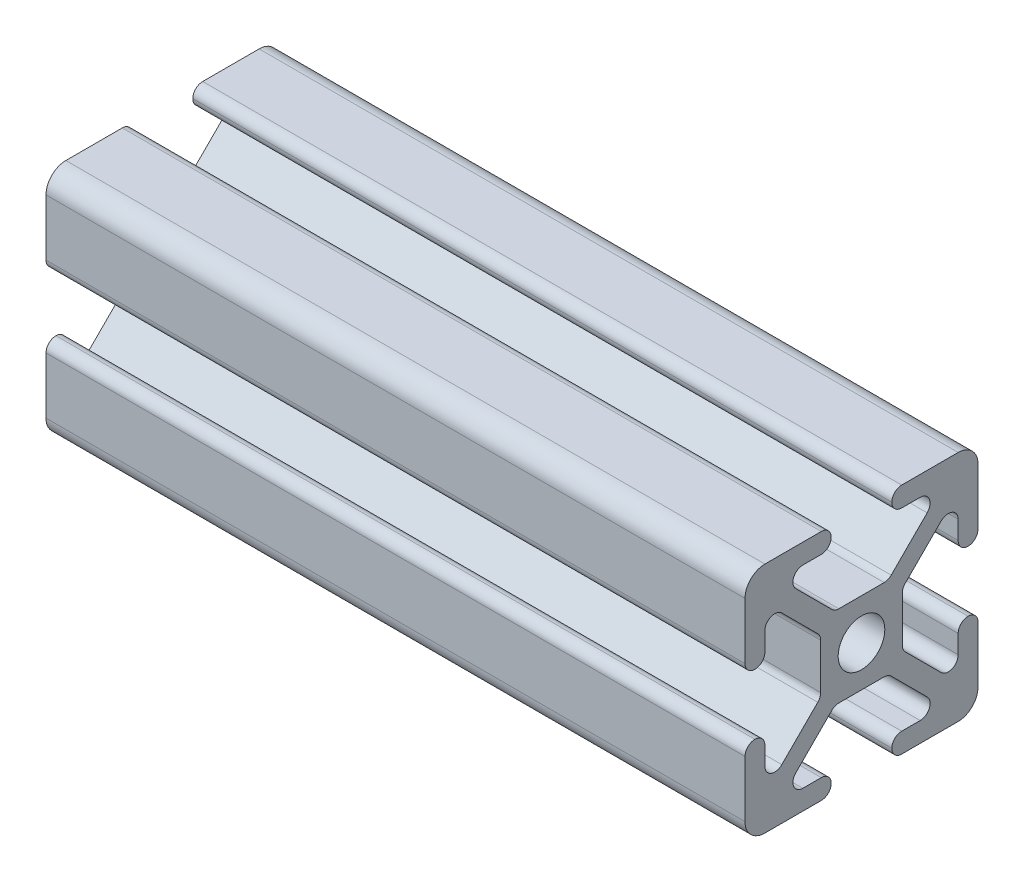
from build123d import *

# Parameters (mm, degrees)
SKETCH1_R           = 2.5
BOSS_EXTRUDE1_DEPTH = 75
FILLET1_R           = 1.065
FILLET2_R           = 2.13


with BuildPart() as part:
    # Sketch1 → Boss-Extrude1 (new body)
    with BuildSketch(Plane.YZ):
        Polygon((-12.5, -3.25), (-12.5, -12.5), (-3.25, -12.5), (-3.25, -10.37), (-8.863862556, -10.37), (-2.873862556, -4.38), (2.873862556, -4.38), (8.863862556, -10.37), (3.25, -10.37), (3.25, -12.5), (12.5, -12.5), (12.5, -3.25), (10.37, -3.25), (10.37, -8.863862556), (4.38, -2.873862556), (4.38, 2.873862556), (10.37, 8.863862556), (10.37, 3.25), (12.5, 3.25), (12.5, 12.5), (3.25, 12.5), (3.25, 10.37), (8.863862556, 10.37), (2.873862556, 4.38), (-2.873862556, 4.38), (-8.863862556, 10.37), (-3.25, 10.37), (-3.25, 12.5), (-12.5, 12.5), (-12.5, 3.25), (-10.37, 3.25), (-10.37, 8.863862556), (-4.38, 2.873862556), (-4.38, -2.873862556), (-10.37, -8.863862556), (-10.37, -3.25), align=None)
        with Locations(Location((0, 0, 0), (0, 0, 270))):
            Circle(SKETCH1_R, mode=Mode.SUBTRACT)
    extrude(amount=BOSS_EXTRUDE1_DEPTH)

    # Fillet1
    fillet1_edges = [part.edges().sort_by_distance(p)[0] for p in [
        (37.5, -10.37, -8.863862556),
        (37.5, 2.873862556, -4.38),
        (37.5, -2.873862556, -4.38),
        (37.5, -4.38, 2.873862556),
        (37.5, -4.38, -2.873862556),
        (37.5, -2.873862556, 4.38),
        (37.5, 2.873862556, 4.38),
        (37.5, 4.38, 2.873862556),
        (37.5, 4.38, -2.873862556),
        (37.5, -8.863862556, -10.37),
        (37.5, 8.863862556, -10.37),
        (37.5, 10.37, -8.863862556),
        (37.5, -10.37, 8.863862556),
        (37.5, -8.863862556, 10.37),
        (37.5, 10.37, 8.863862556),
        (37.5, 8.863862556, 10.37),
        (37.5, 12.5, 3.25),
        (37.5, -3.25, -12.5),
        (37.5, -10.37, 3.25),
        (37.5, 10.37, 3.25),
        (37.5, -10.37, -3.25),
        (37.5, -12.5, -3.25),
        (37.5, -12.5, 3.25),
        (37.5, 3.25, -10.37),
        (37.5, -3.25, -10.37),
        (37.5, 3.25, -12.5),
        (37.5, 10.37, -3.25),
        (37.5, 12.5, -3.25),
        (37.5, 3.25, 12.5),
        (37.5, 3.25, 10.37),
        (37.5, -3.25, 10.37),
        (37.5, -3.25, 12.5),
    ]]
    fillet(fillet1_edges, radius=FILLET1_R - 0.0001)  # a hair under: the kernel refuses the full size

    # Fillet2
    fillet2_edges = [part.edges().sort_by_distance(p)[0] for p in [
        (37.5, -12.5, 12.5),
        (37.5, 12.5, 12.5),
        (37.5, 12.5, -12.5),
        (37.5, -12.5, -12.5),
    ]]
    fillet(fillet2_edges, radius=FILLET2_R)


solid = part.part
